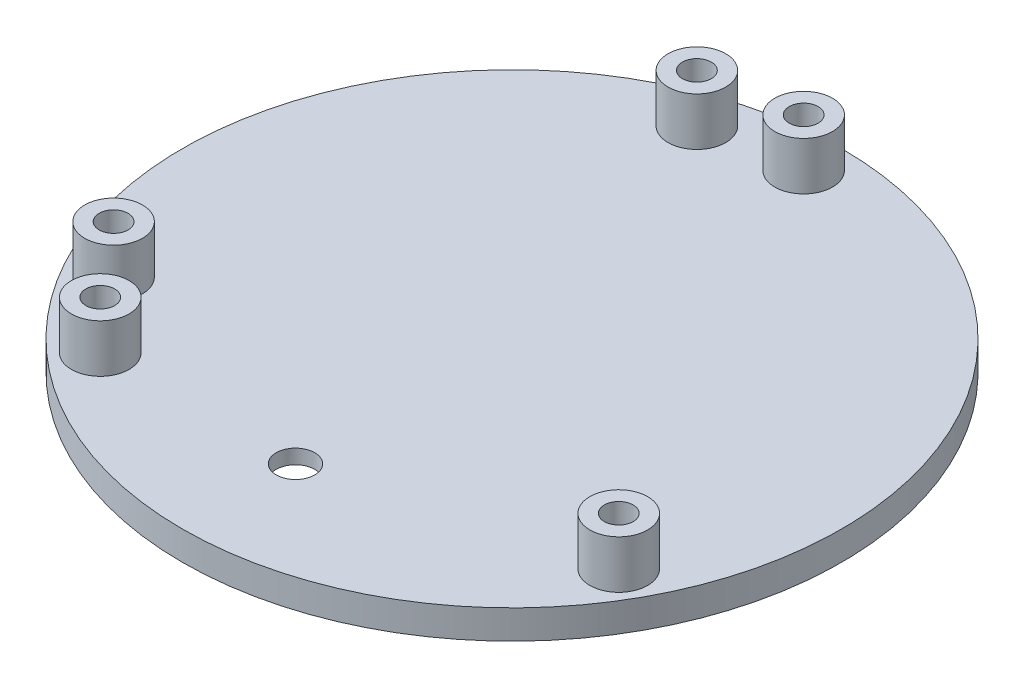
from build123d import *

# Parameters (mm, degrees)
SKETCH2_R           = 6
SKETCH2_R_2         = 3
BOSS_EXTRUDE1_DEPTH = 10
SKETCH3_R           = 4
CUT_EXTRUDE1_DEPTH  = 10


with BuildPart() as part:
    # Sketch1 → Revolve1 (revolve)
    with BuildSketch(Plane.XY):
        with BuildLine():
            Line((0, 0), (68.5, 0))
            Line((68.5, 0), (68.5, -6))
            Line((68.5, -6), (66.5, -6))
            Line((66.5, -6), (66.5, -3))
            Line((66.5, -3), (62.351595203, -3))
            ThreePointArc((62.351595203, -3), (60, -2.3), (57.648404797, -3))
            Line((57.648404797, -3), (53.5, -3))
            Line((53.5, -3), (53.5, -6))
            Line((53.5, -6), (50.5, -6))
            Line((50.5, -6), (50.5, -3))
            Line((50.5, -3), (6, -3))
            Line((6, -3), (6, -5))
            Line((6, -5), (0, -5))
            Line((0, -5), (0, 0))
        make_face()
    revolve(axis=Axis((0, -5, 0), (0, 1, 0)))

    # Sketch2 → Boss-Extrude1 (add)
    # profile 1 of 5: a face of its own
    with BuildSketch(Plane(origin=(0, 0, 0), x_dir=(1, 0, 0), z_dir=(0, 1, 0))):
        with Locations((0, 60.621778265)):
            Circle(SKETCH2_R)
        with Locations((0, 60.621778265)):
            Circle(SKETCH2_R_2, mode=Mode.SUBTRACT)
    # profile 2 of 5: a face of its own
    with BuildSketch(Plane(origin=(0, 0, 0), x_dir=(1, 0, 0), z_dir=(0, 1, 0))):
        with Locations((52.5, -30.310889132)):
            Circle(SKETCH2_R)
        with Locations((52.5, -30.310889132)):
            Circle(SKETCH2_R_2, mode=Mode.SUBTRACT)
    # profile 3 of 5: a face of its own
    with BuildSketch(Plane(origin=(0, 0, 0), x_dir=(1, 0, 0), z_dir=(0, 1, 0))):
        with Locations((-52.5, -30.310889132)):
            Circle(SKETCH2_R)
        with Locations((-52.5, -30.310889132)):
            Circle(SKETCH2_R_2, mode=Mode.SUBTRACT)
    # profile 4 of 5: a face of its own
    with BuildSketch(Plane(origin=(0, 0, 0), x_dir=(1, 0, 0), z_dir=(0, 1, 0))):
        with Locations((-40.273109217, -45.310889132)):
            Circle(SKETCH2_R)
        with Locations((-40.273109217, -45.310889132)):
            Circle(SKETCH2_R_2, mode=Mode.SUBTRACT)
    # profile 5 of 5: a face of its own
    with BuildSketch(Plane(origin=(0, 0, 0), x_dir=(1, 0, 0), z_dir=(0, 1, 0))):
        with Locations((-19.103826448, 57.532980238)):
            Circle(SKETCH2_R)
        with Locations((-19.103826448, 57.532980238)):
            Circle(SKETCH2_R_2, mode=Mode.SUBTRACT)
    extrude(amount=BOSS_EXTRUDE1_DEPTH)

    # Sketch3 → Cut-Extrude1 (cut)
    with BuildSketch(Plane(origin=(0, 0, 0), x_dir=(1, 0, 0), z_dir=(0, 1, 0))):
        with Locations((0, -45)):
            Circle(SKETCH3_R)
    extrude(amount=-CUT_EXTRUDE1_DEPTH, mode=Mode.SUBTRACT)


solid = part.part
